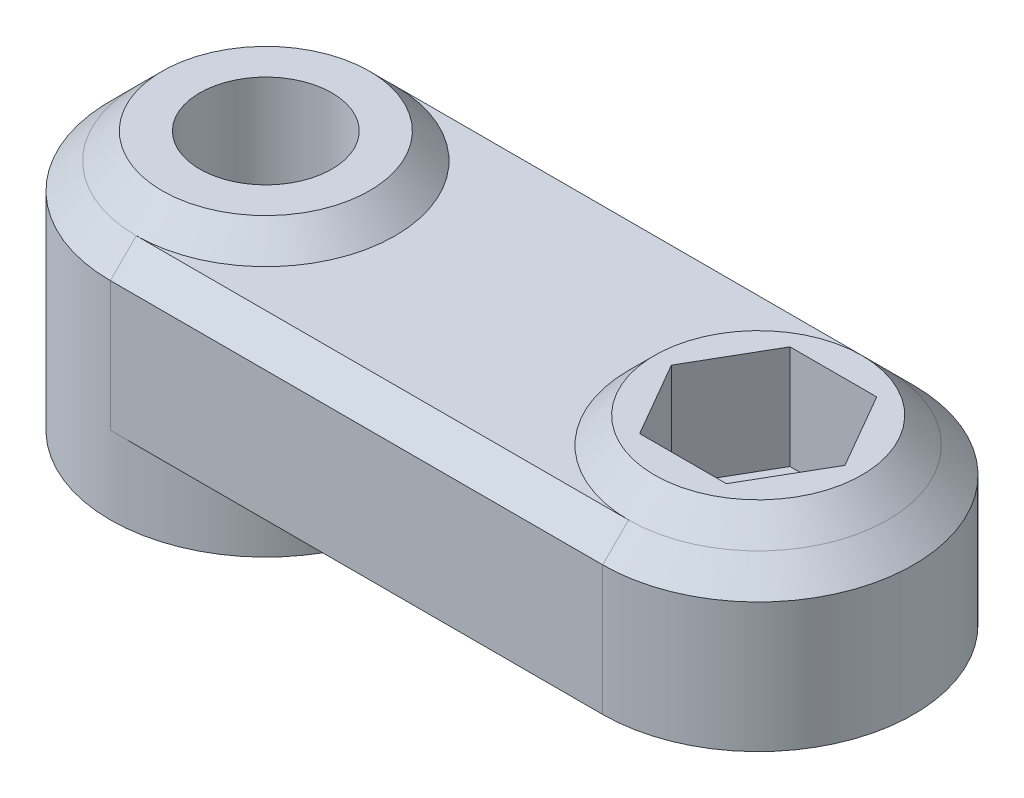
from build123d import *

# Parameters (mm, degrees)
EXTRUDE_1_DEPTH     = 10
CHAMFER_1_SIZE      = 2
CUT_EXTRUDE_1_DEPTH = 5
SKETCH_5_R          = 32.43595028
SKETCH_5_R_2        = 6
CUT_EXTRUDE_2_DEPTH = 3
CUT_EXTRUDE_3_DEPTH = 4
SKETCH_7_W          = 54.061660739
SKETCH_7_H          = 47.527586942
SKETCH_7_R          = 4
CUT_EXTRUDE_4_DEPTH = 1
CHAMFER_2_SIZE      = 1


with BuildPart() as part:
    # 草图1 → 凸台-拉伸1 (new body)
    with BuildSketch(Plane(origin=(0, 0, 0), x_dir=(1, 0, 0), z_dir=(0, 1, 0))):
        with BuildLine():
            Line((0, 6), (19, 6))
            ThreePointArc((19, 6), (25, 0), (19, -6))
            Line((19, -6), (0, -6))
            ThreePointArc((0, -6), (-6, 0), (0, 6))
        make_face()
    extrude(amount=EXTRUDE_1_DEPTH)

    # 草图2 → 切除-旋转1 (revolve, cut)
    with BuildSketch(Plane.XY, mode=Mode.PRIVATE) as cut_revolve_1_sk:
        Polygon((0, 10), (-2.55, 10), (-2.55, 5), (-1.6, 5), (-1.6, 2), (-2.55, 2), (-2.55, 0), (0, 0), align=None)
    revolve(cut_revolve_1_sk.sketch.rotate(Axis((0, -1.427566958, 0), (0, 1, 0)), 270), axis=Axis((0, -1.427566958, 0), (0, 1, 0)), mode=Mode.SUBTRACT)

    # 草图3 → 切除-旋转2 (revolve, cut)
    with BuildSketch(Plane.XY, mode=Mode.PRIVATE) as cut_revolve_2_sk:
        Polygon((19, 0), (16.925, 0), (16.925, 6), (16.5, 6), (16.5, 10), (19, 10), align=None)
    revolve(cut_revolve_2_sk.sketch.rotate(Axis((19, 0, 0), (0, 1, 0)), 270), axis=Axis((19, 0, 0), (0, 1, 0)), mode=Mode.SUBTRACT)

    # 倒角1
    chamfer_1_edges = [part.edges().sort_by_distance(p)[0] for p in [
        (25, 10, 0),
        (9.5, 10, -6),
        (-6, 10, 0),
        (9.5, 10, 6),
    ]]
    chamfer(chamfer_1_edges, length=CHAMFER_1_SIZE)

    # 草图4 → 切除-拉伸1 (cut)
    with BuildSketch(Plane.XZ):
        Polygon((2.107328483, 3.65), (-2.107328483, 3.65), (-4.214656965, 0), (-2.107328483, -3.65), (2.107328483, -3.65), (4.214656965, 0), align=None)
    extrude(amount=-CUT_EXTRUDE_1_DEPTH, mode=Mode.SUBTRACT)

    # 草图5 → 切除-拉伸2 (cut)
    with BuildSketch(Plane.XZ):
        Circle(SKETCH_5_R)
        with Locations(Location((0, 0, 0), (0, 0, 90))):
            Circle(SKETCH_5_R_2, mode=Mode.SUBTRACT)
    extrude(amount=-CUT_EXTRUDE_2_DEPTH, mode=Mode.SUBTRACT)

    # 草图6 → 切除-拉伸3 (cut)
    with BuildSketch(Plane(origin=(0, 10, 0), x_dir=(1, 0, 0), z_dir=(0, 1, 0))):
        Polygon((20.674315781, 2.9), (17.325684219, 2.9), (15.651368439, 0), (17.325684219, -2.9), (20.674315781, -2.9), (22.348631561, 0), align=None)
    extrude(amount=-CUT_EXTRUDE_3_DEPTH, mode=Mode.SUBTRACT)

    # 草图7 → 切除-拉伸4 (cut)
    with BuildSketch(Plane(origin=(0, 10, 0), x_dir=(1, 0, 0), z_dir=(0, 1, 0))):
        with Locations((6.682015694, 1.141108586)):
            Rectangle(SKETCH_7_W, SKETCH_7_H)
        with Locations(Location((0, 0, 0), (0, 0, 270))):
            Circle(SKETCH_7_R, mode=Mode.SUBTRACT)
        with Locations(Location((19, 0, 0), (0, 0, 270))):
            Circle(SKETCH_7_R, mode=Mode.SUBTRACT)
    extrude(amount=-CUT_EXTRUDE_4_DEPTH, mode=Mode.SUBTRACT)

    # 倒角2
    chamfer_2_edges = [part.edges().sort_by_distance(p)[0] for p in [
        (19, 9, -4),
        (0, 9, -4),
    ]]
    chamfer(chamfer_2_edges, length=CHAMFER_2_SIZE - 0.0001)  # a hair under: the kernel refuses the full size


solid = part.part
